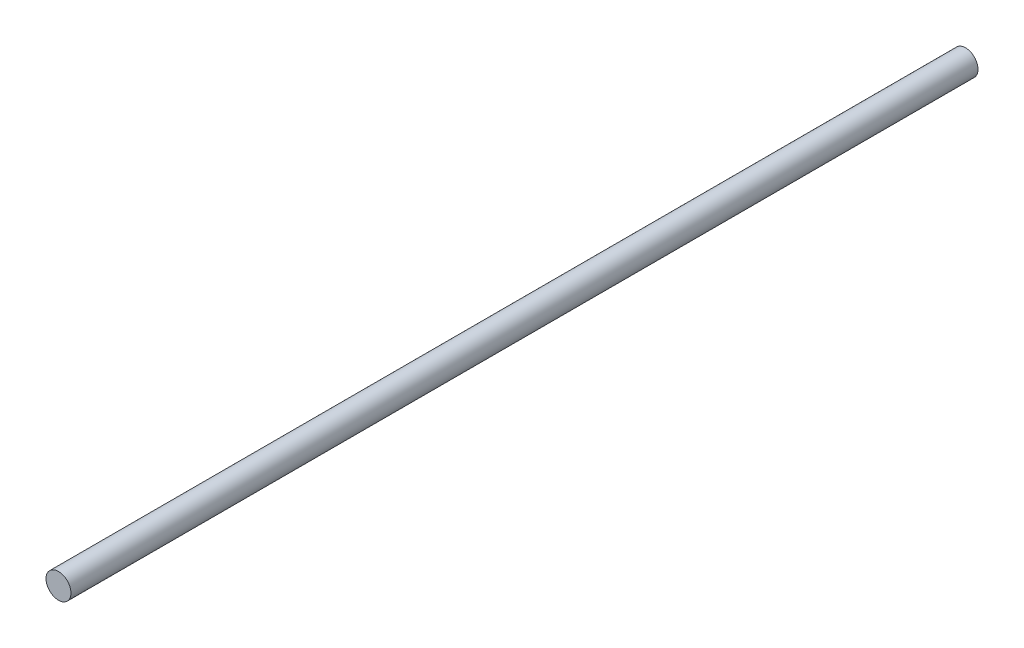
from build123d import *

# Parameters (mm, degrees)
SKETCH1_R           = 2.0955
BOSS_EXTRUDE1_DEPTH = 152.4


with BuildPart() as part:
    # Sketch1 → Boss-Extrude1 (new body)
    with BuildSketch(Plane.XY):
        Circle(SKETCH1_R)
    extrude(amount=BOSS_EXTRUDE1_DEPTH)


solid = part.part
